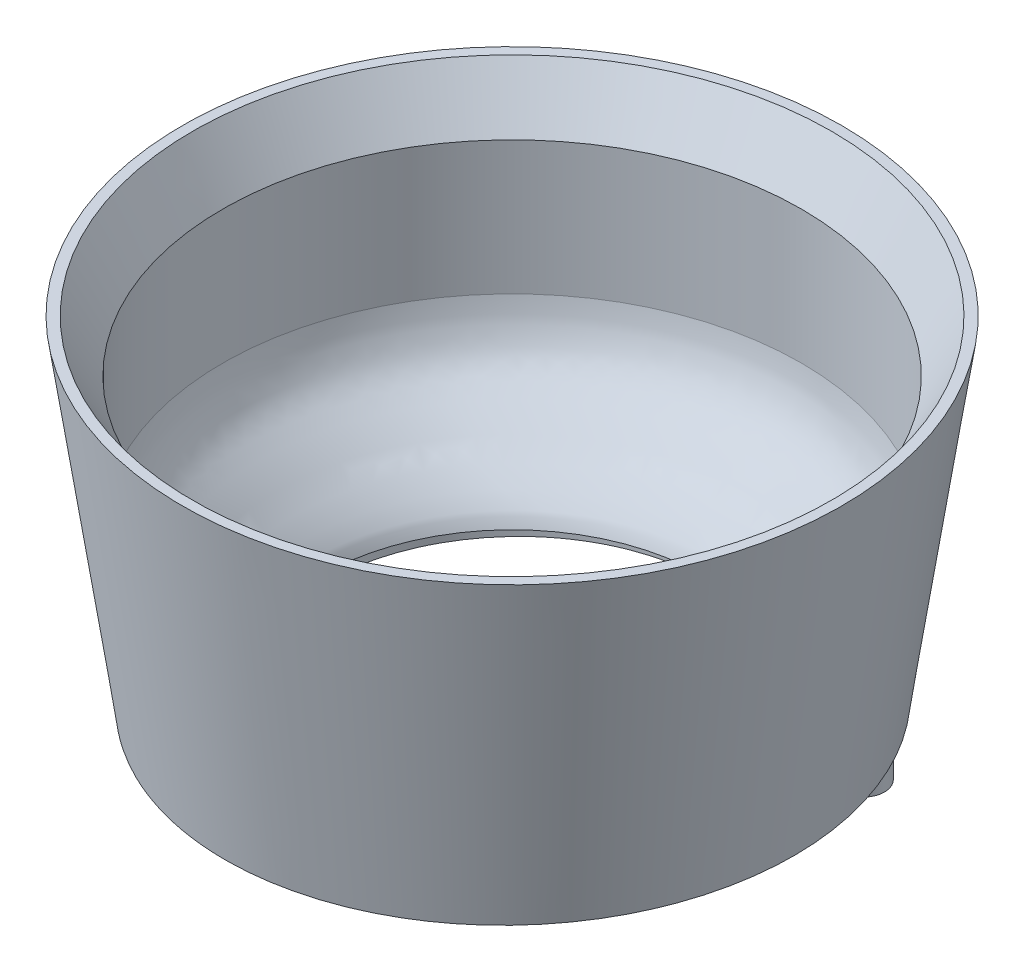
from build123d import *
from OCP.BRepAlgoAPI import BRepAlgoAPI_Cut
from OCP.TopTools import TopTools_ListOfShape

# Parameters (mm, degrees)
SKETCH4_R                       = 3
BOSS_EXTRUDE1_DEPTH             = 2
BOSS_EXTRUDE3_REACH             = 82.882
BOSS_EXTRUDE3_END_RADIUS        = 278.75
SKETCH4_3_R                     = 3
BOSS_EXTRUDE3_DIRECTION_2_DEPTH = 2
SKETCH15_R                      = 1.5
CUT_EXTRUDE3_DEPTH              = 6
SKETCH16_R                      = 2
CUT_EXTRUDE4_DEPTH              = 0.5
CHAMFER3_SIZE                   = 0.55
SKETCH17_R                      = 26.8
CUT_EXTRUDE5_DEPTH              = 83.077692853


with BuildPart() as part:
    # Sketch2 → Revolve6 (revolve)
    with BuildSketch(Plane(origin=(0, 0, 0), x_dir=(0, 0, -1), z_dir=(1, 0, 0))):
        with BuildLine():
            Line((26.5077562, 274.996982717), (26.5077562, 273.848618937))
            Line((26.5077562, 273.848618937), (39.220771912, 273.848618937))
            Line((39.220771912, 273.848618937), (46.181267187, 321.561079724))
            Line((46.181267187, 321.561079724), (44.775299462, 321.561079724))
            Line((44.775299462, 321.561079724), (40.547674755, 314.238618937))
            Line((40.547674755, 314.238618937), (40.547674755, 295.540718438))
            add(Edge.make_bspline(
                [(40.547674755, 295.540718438), (40.447740466, 295.012709616), (40.292777353, 293.970757619), (39.930889755, 292.587532753), (39.516186416, 291.581451359), (39.108370782, 290.57804728), (38.439698054, 289.316986818), (37.331416086, 288.032583079), (36.368363881, 287.115418474), (35.630231264, 286.340079673), (35.016472726, 285.762737126), (34.394259795, 285.247169223), (33.635524662, 284.556557999), (32.920361334, 283.771384038), (32.129651901, 282.986073936), (31.485241784, 282.459482323), (30.914997208, 281.963476573), (30.371700346, 281.391298159), (29.782796159, 280.80462685), (29.227584581, 280.262154528), (28.724752618, 279.674853681), (28.180386253, 279.039651715), (27.651838315, 278.470209992), (27.308145935, 277.876839187), (26.995230081, 277.127164256), (26.597952618, 276.164510632), (26.464811583, 275.470548141), (26.5077562, 274.996982717)],
                knots=[0, 0, 0, 0, 0.062544048, 0.125088096, 0.156360121, 0.187632145, 0.250176193, 0.312720241, 0.375264289, 0.406536313, 0.437808337, 0.469080362, 0.500352386, 0.562896434, 0.594168458, 0.625440482, 0.656712506, 0.68798453, 0.719256554, 0.750528579, 0.781800603, 0.813072627, 0.844344651, 0.875616675, 0.906888699, 0.938160723, 1.000704771, 1.000704771, 1.000704771, 1.000704771], degree=3))
        make_face()
    revolve(axis=Axis((0, 5, 0), (0, 1, 0)))

    # Sketch4 → Boss-Extrude1 (add)
    with BuildSketch(Plane.XZ.offset(-273.848618937)):
        with Locations(Location((-36, 0, 0), (0, 0, 270))):
            Circle(SKETCH4_R)
        with Locations(Location((31.176914536, -18, 0), (0, 0, 270))):
            Circle(SKETCH4_R)
    extrude(amount=BOSS_EXTRUDE1_DEPTH)

    # Sketch7 → Revolve7 (revolve)
    with BuildSketch(Plane(origin=(0, 0, 0), x_dir=(0, 0, -1), z_dir=(1, 0, 0))):
        with BuildLine():
            Line((39.220771912, 273.848618937), (39.220771912, 272.319355593))
            ThreePointArc((39.220771912, 272.319355593), (32.873157949, 273.157923648), (26.5077562, 273.848618937))
            Line((26.5077562, 273.848618937), (26.5077562, 274.348618937))
            Line((26.5077562, 274.348618937), (39.220771912, 274.348618937))
            Line((39.220771912, 274.348618937), (39.220771912, 273.848618937))
        make_face()
    revolve(axis=Axis((0, 5, 0), (0, 1, 0)))


with BuildPart() as cut_revolve6_tool:
    # Sketch13 → Cut-Revolve6 (revolve)
    with BuildSketch(Plane.XY):
        with BuildLine():
            Line((39.220771912, 265.819355593), (19.220771912, 265.819355593))
            Line((19.220771912, 265.819355593), (19.220771912, 277.417327684))
            ThreePointArc((19.220771912, 277.417327684), (30.741102516, 276.673911793), (42.220771912, 275.454126993))
            Line((42.220771912, 275.454126993), (42.220771912, 265.819355593))
            Line((42.220771912, 265.819355593), (39.220771912, 265.819355593))
        make_face()
    revolve(axis=Axis((0, 274.819355593, 0), (0.025488410068669705, -0.9996751177018318, 0)))


with BuildPart() as part_1:
    add(part.part)

    # Cut-Revolve6: cut by cut_revolve6_tool, with a tolerance
    cut_revolve6_stock = TopTools_ListOfShape()
    cut_revolve6_stock.Append(part_1.part.wrapped)
    cut_revolve6_tools = TopTools_ListOfShape()
    cut_revolve6_tools.Append(cut_revolve6_tool.part.wrapped)
    cut_revolve6_cut = BRepAlgoAPI_Cut()
    cut_revolve6_cut.SetArguments(cut_revolve6_stock)
    cut_revolve6_cut.SetTools(cut_revolve6_tools)
    cut_revolve6_cut.SetFuzzyValue(0.00001)
    cut_revolve6_cut.Build()
    add(Compound.cast(cut_revolve6_cut.Shape()).solids(), mode=Mode.REPLACE)

    # Boss-Extrude3: up to this sphere (the profile starts inside it)
    boss_extrude3_end = Location((7.03416826, -1.066153319, 0)) * Sphere(BOSS_EXTRUDE3_END_RADIUS, mode=Mode.PRIVATE)
    # Sketch4<3> → Boss-Extrude3 (add, up to the surface)
    with BuildSketch(Plane.XZ.offset(-273.848618937), mode=Mode.PRIVATE) as boss_extrude3_sk1:
        with Locations(Location((-36, 0, 0), (0, 0, 226.558195767))):
            Circle(SKETCH4_3_R)
    boss_extrude3_tool1 = extrude(boss_extrude3_sk1.sketch, amount=-BOSS_EXTRUDE3_REACH, mode=Mode.PRIVATE) & boss_extrude3_end
    add(boss_extrude3_tool1.solids().sort_by_distance((-36, 273.848619, 0))[0])
    # Sketch4<3> → Boss-Extrude3 (add, up to the surface)
    with BuildSketch(Plane.XZ.offset(-273.848618937), mode=Mode.PRIVATE) as boss_extrude3_sk2:
        with Locations(Location((31.176914536, -18, 0), (0, 0, 224.101104304))):
            Circle(SKETCH4_3_R)
    boss_extrude3_tool2 = extrude(boss_extrude3_sk2.sketch, amount=-BOSS_EXTRUDE3_REACH, mode=Mode.PRIVATE) & boss_extrude3_end
    add(boss_extrude3_tool2.solids().sort_by_distance((31.176915, 273.848619, -18))[0])

    # Sketch4<3> → Boss-Extrude3 direction 2 (add)
    with BuildSketch(Plane.XZ.offset(-273.848618937)):
        with Locations(Location((-36, 0, 0), (0, 0, 226.558195767))):
            Circle(SKETCH4_3_R)
        with Locations(Location((31.176914536, -18, 0), (0, 0, 224.101104304))):
            Circle(SKETCH4_3_R)
    extrude(amount=BOSS_EXTRUDE3_DIRECTION_2_DEPTH)

    # Sketch15 → Cut-Extrude3 (cut)
    with BuildSketch(Plane.XZ.offset(-271.848618937)):
        with Locations(Location((-36, 0, 0), (0, 0, 270))):
            Circle(SKETCH15_R)
        with Locations(Location((31.176914536, -18, 0), (0, 0, 270))):
            Circle(SKETCH15_R)
    extrude(amount=-CUT_EXTRUDE3_DEPTH, mode=Mode.SUBTRACT)

    # Sketch16 → Cut-Extrude4 (cut)
    with BuildSketch(Plane.XZ.offset(-271.848618937)):
        with Locations(Location((-36, 0, 0), (0, 0, 270))):
            Circle(SKETCH16_R)
        with Locations(Location((31.176914536, -18, 0), (0, 0, 270))):
            Circle(SKETCH16_R)
    extrude(amount=-CUT_EXTRUDE4_DEPTH, mode=Mode.SUBTRACT)

    # Chamfer3
    # the kernel refuses this chamfer: 0.55 mm, written as the material it takes off along each edge
    with BuildSketch(Plane(origin=(-36, 271.848618937, 0), x_dir=(0, 0, -1), z_dir=(-1, 0, 0))) as chamfer3_piece_1_section:
        Polygon((2 + CHAMFER3_SIZE, 0), (2, -CHAMFER3_SIZE), (2, 0), align=None)
    chamfer3_piece_1 = revolve(axis=Axis((-36, 271.848618937, 0), (0, -1, 0)), mode=Mode.PRIVATE)
    chamfer3_piece_1 = split(chamfer3_piece_1, bisect_by=Plane(origin=(-36, 272.348618937, 0), z_dir=(0, -1, 0)), keep=Keep.TOP, mode=Mode.PRIVATE)
    add(chamfer3_piece_1, mode=Mode.SUBTRACT)
    with BuildSketch(Plane(origin=(31.176914536, 271.848618937, -18), x_dir=(0, 0, -1), z_dir=(-1, 0, 0))) as chamfer3_piece_2_section:
        Polygon((2 + CHAMFER3_SIZE, 0), (2, -CHAMFER3_SIZE), (2, 0), align=None)
    chamfer3_piece_2 = revolve(axis=Axis((31.176914536, 271.848618937, -18), (0, -1, 0)), mode=Mode.PRIVATE)
    chamfer3_piece_2 = split(chamfer3_piece_2, bisect_by=Plane(origin=(31.176914536, 272.348618937, -18), z_dir=(0, -1, 0)), keep=Keep.TOP, mode=Mode.PRIVATE)
    add(chamfer3_piece_2, mode=Mode.SUBTRACT)

    # Sketch17 → Cut-Extrude5 (cut, through all)
    with BuildSketch(Plane(origin=(0, 321.561079724, 0), x_dir=(1, 0, 0), z_dir=(0, 1, 0))):
        Circle(SKETCH17_R)
    extrude(amount=-CUT_EXTRUDE5_DEPTH, mode=Mode.SUBTRACT)


solid = part_1.part
